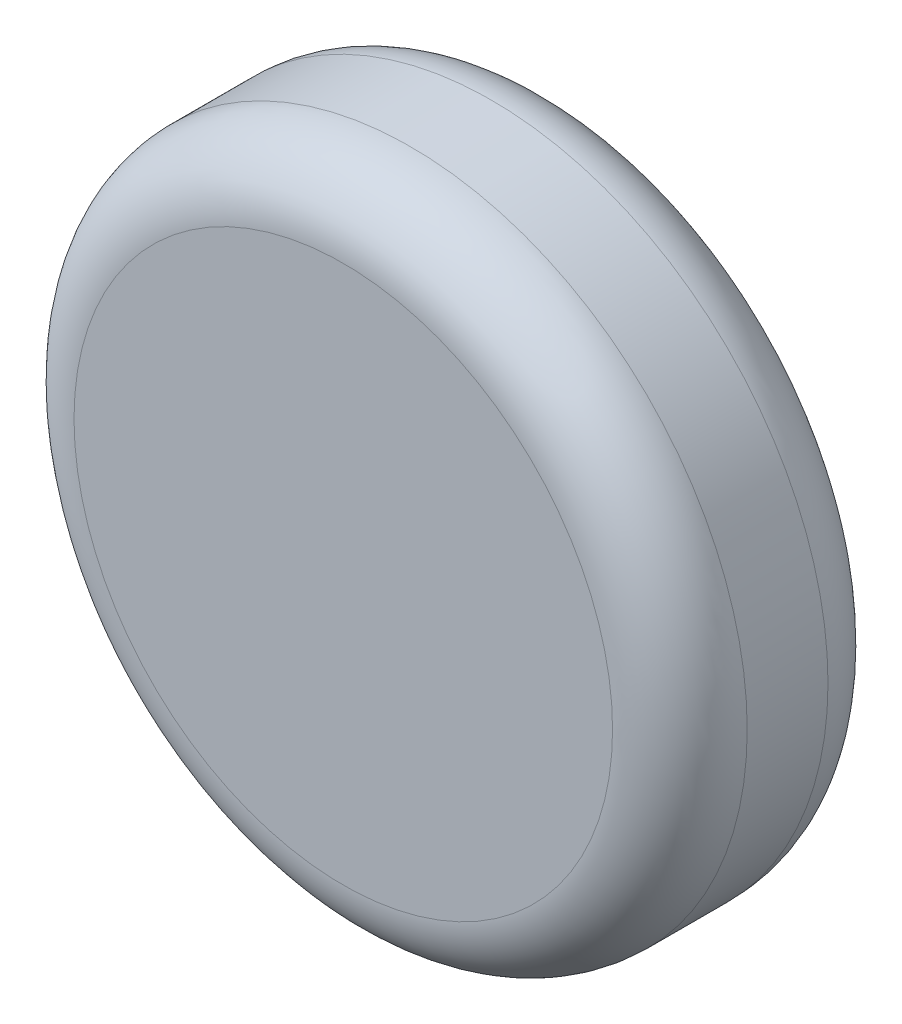
from build123d import *

# Parameters (mm, degrees)
SKETCH_1_R      = 50
EXTRUDE_1_DEPTH = 32
FILLET_1_R      = 10
SKETCH_2_R      = 5
EXTRUDE_2_DEPTH = 25


with BuildPart() as part:
    # Эскиз1 → Бобышка-Вытянуть1 (new body)
    with BuildSketch(Plane.XY):
        Circle(SKETCH_1_R)
    extrude(amount=EXTRUDE_1_DEPTH)

    # Скругление1
    fillet_1_edges = [part.edges().sort_by_distance(p)[0] for p in [
        (-50, 0, 0),
        (-50, 0, 32),
    ]]
    fillet(fillet_1_edges, radius=FILLET_1_R)

    # Эскиз2 → Бобышка-Вытянуть2 (add)
    with BuildSketch(Plane(origin=(0, 0, 0), x_dir=(-1, 0, 0), z_dir=(0, 0, -1))):
        Circle(SKETCH_2_R)
        with BuildLine():
            Line((-1.198957881, 2.75), (1.198957881, 2.75))
            ThreePointArc((1.198957881, 2.75), (3, 0), (1.198957881, -2.75))
            Line((1.198957881, -2.75), (-1.198957881, -2.75))
            ThreePointArc((-1.198957881, -2.75), (-3, 0), (-1.198957881, 2.75))
        make_face(mode=Mode.SUBTRACT)
    extrude(amount=EXTRUDE_2_DEPTH)


solid = part.part
